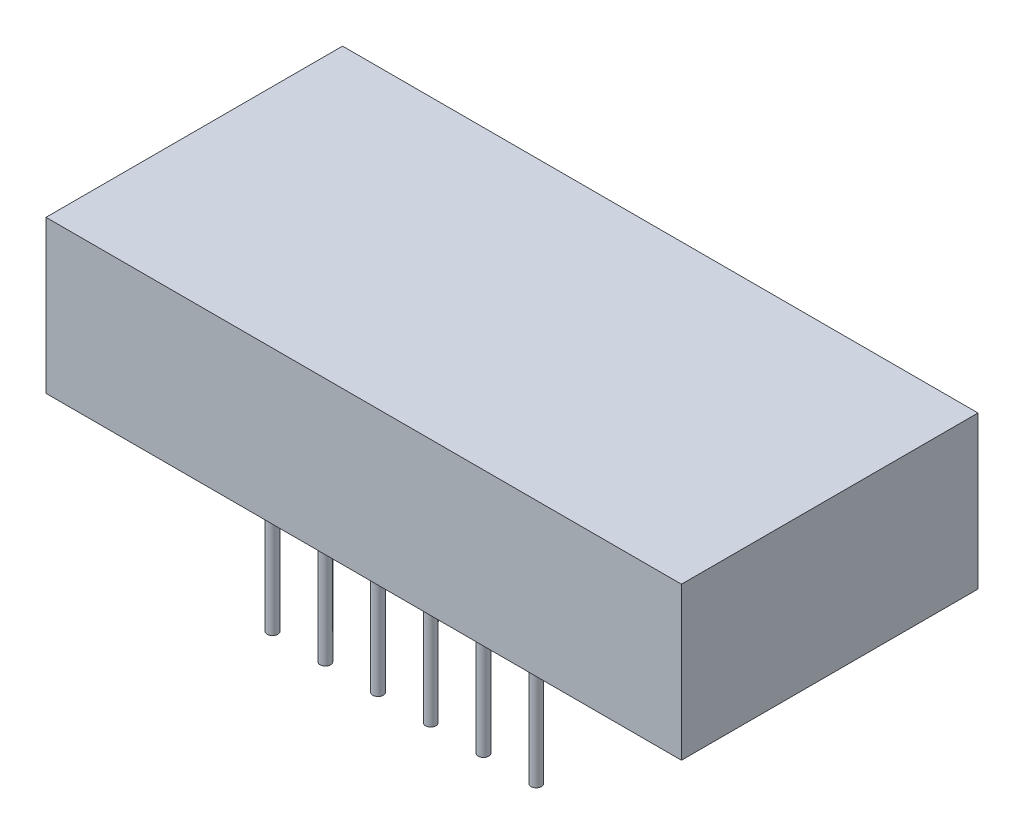
from build123d import *

# Parameters (mm, degrees)
SKETCH_1_W      = 30
SKETCH_1_H      = 14
EXTRUDE_1_DEPTH = 7.2
SKETCH_2_R      = 0.25
EXTRUDE_2_DEPTH = 6.3


with BuildPart() as part:
    # 草图1 → 拉伸1 (new body)
    with BuildSketch(Plane(origin=(0, 0, 0), x_dir=(1, 0, 0), z_dir=(0, 1, 0))):
        Rectangle(SKETCH_1_W, SKETCH_1_H)
    extrude(amount=EXTRUDE_1_DEPTH)

    # 草图2 → 拉伸2 (add)
    with BuildSketch(Plane.XZ):
        with Locations((6.224686657, 5.08)):
            Circle(SKETCH_2_R)
        with Locations((3.734811994, 5.08)):
            Circle(SKETCH_2_R)
        with Locations((1.244937331, 5.08)):
            Circle(SKETCH_2_R)
        with Locations((-1.244937331, 5.08)):
            Circle(SKETCH_2_R)
        with Locations((-3.734811994, 5.08)):
            Circle(SKETCH_2_R)
        with Locations((-6.224686657, 5.08)):
            Circle(SKETCH_2_R)
        with Locations((-6.224686657, -5.08)):
            Circle(SKETCH_2_R)
        with Locations((-3.734811994, -5.08)):
            Circle(SKETCH_2_R)
        with Locations((-1.244937331, -5.08)):
            Circle(SKETCH_2_R)
        with Locations((1.244937331, -5.08)):
            Circle(SKETCH_2_R)
        with Locations((3.734811994, -5.08)):
            Circle(SKETCH_2_R)
        with Locations((6.224686657, -5.08)):
            Circle(SKETCH_2_R)
    extrude(amount=EXTRUDE_2_DEPTH)


solid = part.part
